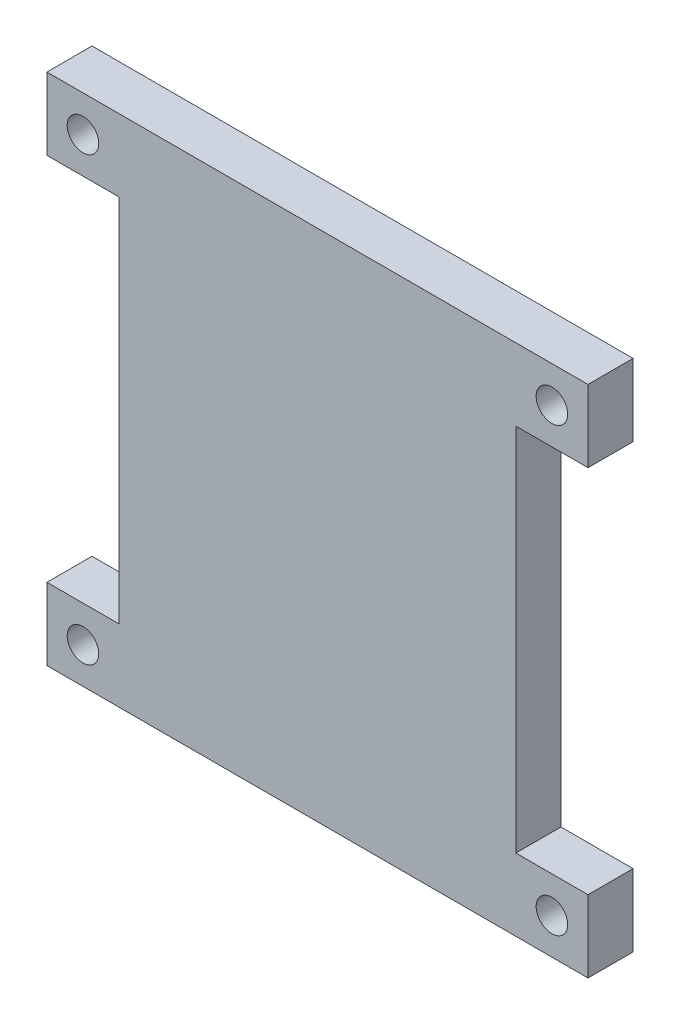
from build123d import *

# Parameters (mm, degrees)
SKETCH_1_R      = 1.75
EXTRUDE_1_DEPTH = 5


with BuildPart() as part:
    # 草圖1 → 填料-伸長1 (new body)
    with BuildSketch(Plane.XY):
        Polygon((-30, 28.5), (-30, 20.5), (-22, 20.5), (-22, -20.5), (-30, -20.5), (-30, -28.5), (30, -28.5), (30, -20.5), (22, -20.5), (22, 20.5), (30, 20.5), (30, 28.5), align=None)
        with Locations((26, 24.5)):
            Circle(SKETCH_1_R, mode=Mode.SUBTRACT)
        with Locations((26, -24.5)):
            Circle(SKETCH_1_R, mode=Mode.SUBTRACT)
        with Locations((-26, -24.5)):
            Circle(SKETCH_1_R, mode=Mode.SUBTRACT)
        with Locations((-26, 24.5)):
            Circle(SKETCH_1_R, mode=Mode.SUBTRACT)
    extrude(amount=EXTRUDE_1_DEPTH)


solid = part.part
